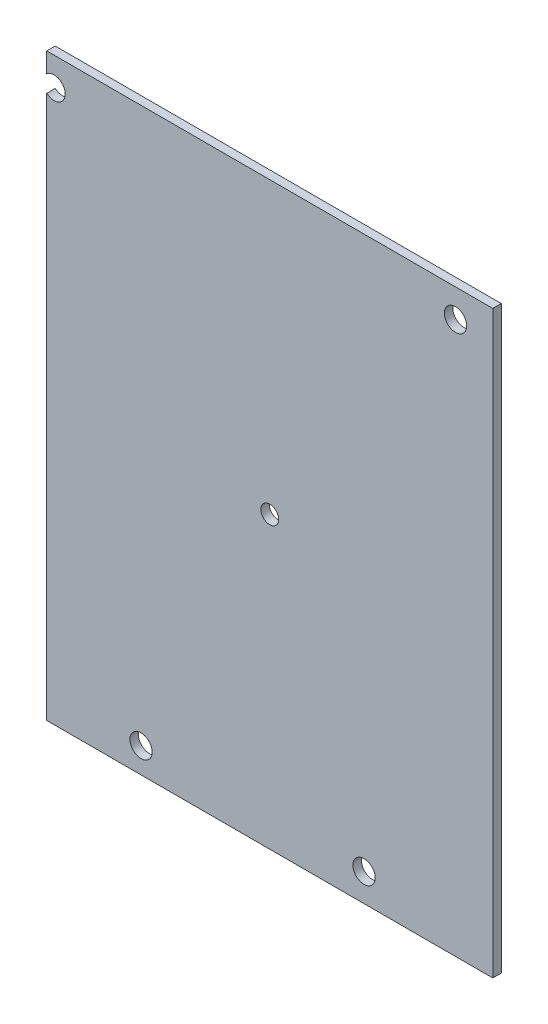
from build123d import *

# Parameters (mm, degrees)
SKETCH1_W          = 100
SKETCH1_H          = 130
BASE_FLANGE1_DEPTH = 1.89738
SKETCH6_R          = 2.5
SKETCH6_R_2        = 2
CUT_EXTRUDE1_DEPTH = 2


# Sheet-metal steps are written as plain solids
with BuildPart() as part:
    # Sketch1 → Base-Flange1 (new body)
    with BuildSketch(Plane.XY):
        with Locations((14.222394098, 9.509380067)):
            Rectangle(SKETCH1_W, SKETCH1_H)
    extrude(amount=-BASE_FLANGE1_DEPTH)

    # Sketch6 → Cut-Extrude1 (cut)
    with BuildSketch(Plane.XY):
        with Locations((-34.133449647, 68.173545131)):
            Circle(SKETCH6_R)
        with Locations((55.866550353, 68.173545131)):
            Circle(SKETCH6_R)
        with Locations((35.363186693, -49.246493887)):
            Circle(SKETCH6_R)
        with Locations((-14.633449647, -49.826454869)):
            Circle(SKETCH6_R)
        with Locations((14.222394098, 9.509380067)):
            Circle(SKETCH6_R_2)
    extrude(amount=-CUT_EXTRUDE1_DEPTH, mode=Mode.SUBTRACT)


solid = part.part
